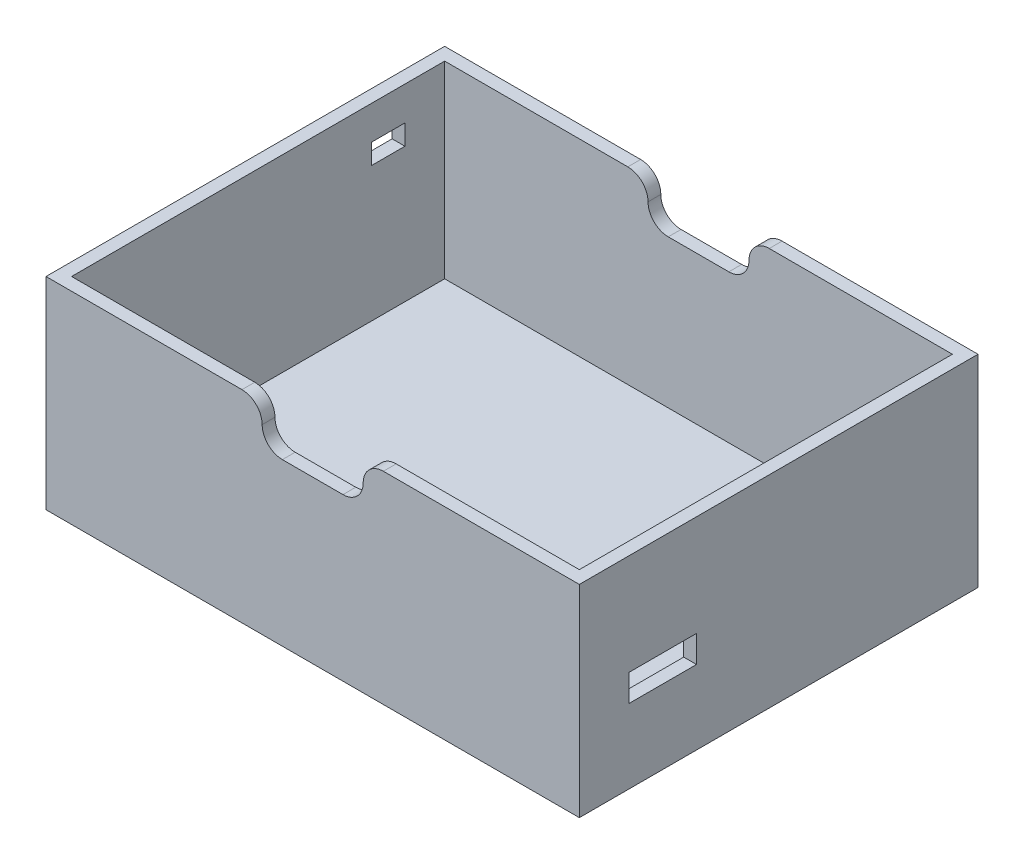
from build123d import *

# Parameters (mm, degrees)
SKETCH1_W           = 100.584
SKETCH1_H           = 75.184
BOSS_EXTRUDE1_DEPTH = 2.54
SKETCH2_W           = 100.584
SKETCH2_H           = 75.184
SKETCH2_W_2         = 95.758
SKETCH2_H_2         = 70.358
BOSS_EXTRUDE2_DEPTH = 35.56
SKETCH3_W           = 19.05
SKETCH3_H           = 7.62
CUT_EXTRUDE1_DEPTH  = 132.230274373
FILLET1_R           = 3.81
SKETCH4_W           = 6.35
SKETCH4_H           = 3.81
CUT_EXTRUDE2_DEPTH  = 6.35
SKETCH5_W           = 12.7
SKETCH5_H           = 5.08
CUT_EXTRUDE3_DEPTH  = 6.35


with BuildPart() as part:
    # Sketch1 → Boss-Extrude1 (new body)
    with BuildSketch(Plane(origin=(0, 0, 0), x_dir=(1, 0, 0), z_dir=(0, 1, 0))):
        with Locations((50.292, 37.592)):
            Rectangle(SKETCH1_W, SKETCH1_H)
    extrude(amount=BOSS_EXTRUDE1_DEPTH)

    # Sketch2 → Boss-Extrude2 (add)
    with BuildSketch(Plane(origin=(0, 2.54, 0), x_dir=(1, 0, 0), z_dir=(0, 1, 0))):
        with Locations((50.292, 37.592)):
            Rectangle(SKETCH2_W, SKETCH2_H)
        with Locations((50.292, 37.592)):
            Rectangle(SKETCH2_W_2, SKETCH2_H_2, mode=Mode.SUBTRACT)
    extrude(amount=BOSS_EXTRUDE2_DEPTH)

    # Sketch3 → Cut-Extrude1 (cut, through all)
    with BuildSketch(Plane(origin=(0, 0, -75.184), x_dir=(-1, 0, 0), z_dir=(0, 0, -1))):
        with Locations((-50.292, 34.29)):
            Rectangle(SKETCH3_W, SKETCH3_H)
    extrude(amount=-CUT_EXTRUDE1_DEPTH, mode=Mode.SUBTRACT)

    # Fillet1
    fillet1_edges = [part.edges().sort_by_distance(p)[0] for p in [
        (40.767, 30.48, -1.2065),
        (59.817, 30.48, -1.2065),
        (59.817, 30.48, -73.9775),
        (40.767, 30.48, -73.9775),
    ]]
    fillet(fillet1_edges, radius=FILLET1_R)
    fillet1_2_edges = [part.edges().sort_by_distance(p)[0] for p in [
        (40.767, 38.1, -1.2065),
        (59.817, 38.1, -1.2065),
        (59.817, 38.1, -73.9775),
        (40.767, 38.1, -73.9775),
    ]]
    fillet(fillet1_2_edges, radius=FILLET1_R - 0.0001)  # a hair under: the kernel refuses the full size

    # Sketch4 → Cut-Extrude2 (cut)
    with BuildSketch(Plane.ZY):
        with Locations((-62.103, 29.845254)):
            Rectangle(SKETCH4_W, SKETCH4_H)
    extrude(amount=-CUT_EXTRUDE2_DEPTH, mode=Mode.SUBTRACT)

    # Sketch5 → Cut-Extrude3 (cut)
    with BuildSketch(Plane(origin=(100.584, 0, 0), x_dir=(0, 0, -1), z_dir=(1, 0, 0))):
        with Locations((15.748, 16.510254)):
            Rectangle(SKETCH5_W, SKETCH5_H)
    extrude(amount=-CUT_EXTRUDE3_DEPTH, mode=Mode.SUBTRACT)


solid = part.part
